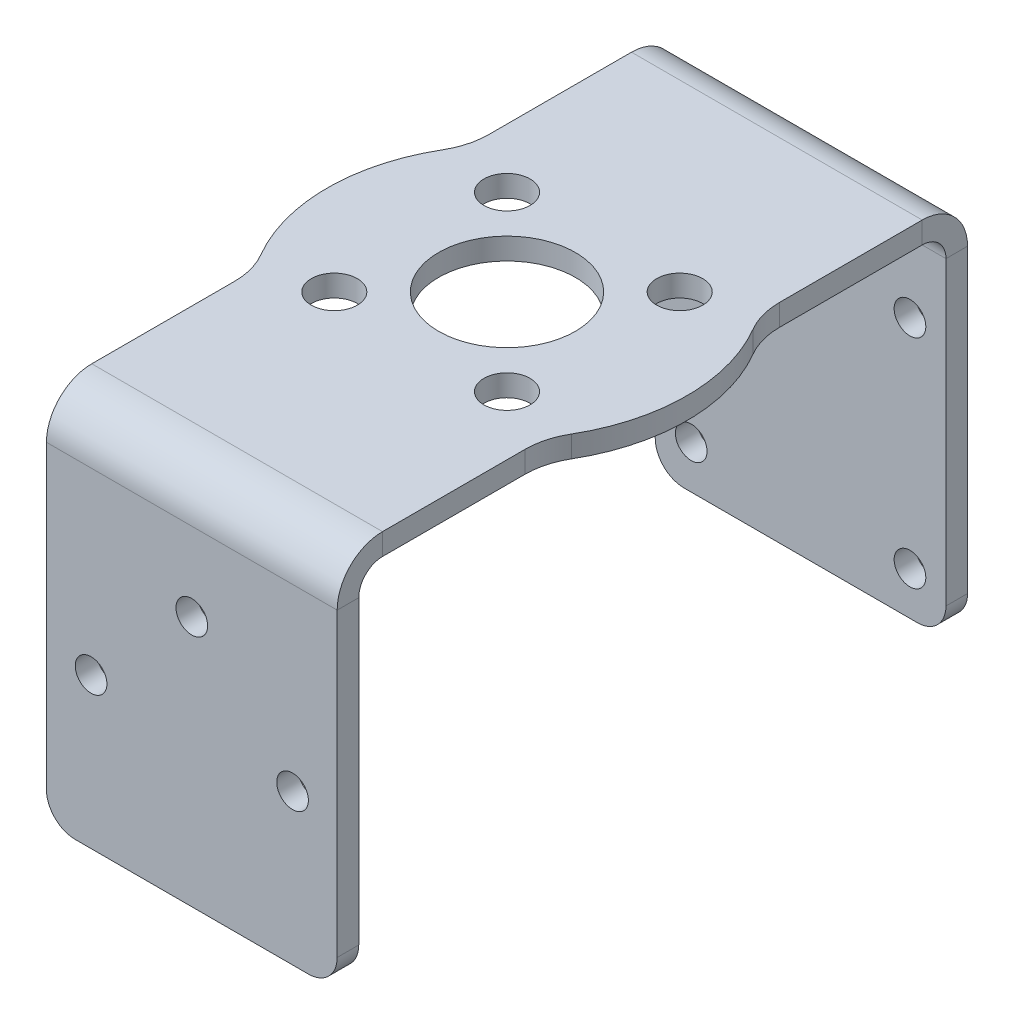
from build123d import *

# Parameters (mm, degrees)
SKETCH1_W                      = 20.2
SKETCH1_H                      = 40.8
BASE_FLANGE1_DEPTH             = 1.5
EDGE_FLANGE1_STRIP_W           = 9.3
EDGE_FLANGE1_STRIP_H           = 1.5
EDGE_FLANGE1_STRIP_CUT_DEPTH   = 20.2
EDGE_FLANGE1_STRIP_2_W         = 9.3
EDGE_FLANGE1_STRIP_2_H         = 1.5
EDGE_FLANGE1_STRIP_CUT_2_DEPTH = 20.2
EDGE_FLANGE1_DEPTH             = 20.2
EDGE_FLANGE1_BEND_DEPTH        = 20.2
CUT_EXTRUDE1_REACH             = 53.952
SKETCH12_R                     = 1.1
FILLET1_R                      = 2
F_2_0MM_DOWEL_HOLE1_D          = 2.2
F_2_0MM_DOWEL_HOLE1_DEPTH      = 1.5
SKETCH15_R                     = 12.5
TAB1_DEPTH                     = 1.5
FILLET2_R                      = 5
CUT_EXTRUDE2_REACH             = 38.256
SKETCH18_R                     = 1.6
SKETCH18_R_2                   = 4.75


# Sheet-metal steps are written as plain solids
with BuildPart() as part:
    # Sketch1 → Base-Flange1 (new body)
    with BuildSketch(Plane(origin=(0, 0, 0), x_dir=(1, 0, 0), z_dir=(0, 1, 0))):
        Rectangle(SKETCH1_W, SKETCH1_H)
    extrude(amount=-BASE_FLANGE1_DEPTH)

    # Edge-Flange1 strip (across the edge) → Edge-Flange1 strip cut (cut)
    with BuildSketch(Plane(origin=(10.1, -1.5, 20.4), x_dir=(0, 0, -1), z_dir=(-1, 0, 0))):
        with Locations((-3, -0.75)):
            Rectangle(EDGE_FLANGE1_STRIP_W, EDGE_FLANGE1_STRIP_H)
    extrude(amount=EDGE_FLANGE1_STRIP_CUT_DEPTH, mode=Mode.SUBTRACT)

    # Edge-Flange1 strip 2 (across the edge) → Edge-Flange1 strip cut 2 (cut)
    with BuildSketch(Plane(origin=(-10.1, -1.5, -20.4), x_dir=(0, 0, 1), z_dir=(1, 0, 0))):
        with Locations((-3, -0.75)):
            Rectangle(EDGE_FLANGE1_STRIP_2_W, EDGE_FLANGE1_STRIP_2_H)
    extrude(amount=EDGE_FLANGE1_STRIP_CUT_2_DEPTH, mode=Mode.SUBTRACT)

    # Edge-Flange1 section (across the edge) → Edge-Flange1 (add)
    with BuildSketch(Plane(origin=(10.1, -1.5, 20.4), x_dir=(0, 0, -1), z_dir=(-1, 0, 0))):
        with BuildLine():
            Line((-1.5, 1.65), (-1.5, 24.55))
            Line((-1.5, 24.55), (0, 24.55))
            Line((0, 24.55), (0, 1.65))
            ThreePointArc((0, 1.65), (0.483273811, 0.483273811), (1.65, 0))
            Line((1.65, 0), (1.65, -1.5))
            ThreePointArc((1.65, -1.5), (-0.577386361, -0.577386361), (-1.5, 1.65))
        make_face()
    extrude(amount=EDGE_FLANGE1_DEPTH)

    # Edge-Flange1 section 2 (across the edge) → Edge-Flange1 bend (add)
    with BuildSketch(Plane(origin=(-10.1, -1.5, -20.4), x_dir=(0, 0, 1), z_dir=(1, 0, 0))):
        with BuildLine():
            Line((-1.5, 1.65), (-1.5, 24.55))
            Line((-1.5, 24.55), (0, 24.55))
            Line((0, 24.55), (0, 1.65))
            ThreePointArc((0, 1.65), (0.483273811, 0.483273811), (1.65, 0))
            Line((1.65, 0), (1.65, -1.5))
            ThreePointArc((1.65, -1.5), (-0.577386361, -0.577386361), (-1.5, 1.65))
        make_face()
    extrude(amount=EDGE_FLANGE1_BEND_DEPTH)

    # Sketch12 → Cut-Extrude1 (cut, up to next)
    with BuildSketch(Plane(origin=(0, 0, -21.9), x_dir=(-1, 0, 0), z_dir=(0, 0, -1)), mode=Mode.PRIVATE) as cut_extrude1_sk1:
        with Locations(Location((-7.6, -7.95, 0), (0, 0, 90))):
            Circle(SKETCH12_R)
    cut_extrude1_tool1 = extrude(cut_extrude1_sk1.sketch, amount=-CUT_EXTRUDE1_REACH, mode=Mode.PRIVATE) & part.part
    # Sketch12 → Cut-Extrude1 (cut, up to next)
    with BuildSketch(Plane(origin=(0, 0, -21.9), x_dir=(-1, 0, 0), z_dir=(0, 0, -1)), mode=Mode.PRIVATE) as cut_extrude1_sk2:
        with Locations(Location((7.6, -7.95, 0), (0, 0, 90))):
            Circle(SKETCH12_R)
    cut_extrude1_tool2 = extrude(cut_extrude1_sk2.sketch, amount=-CUT_EXTRUDE1_REACH, mode=Mode.PRIVATE) & part.part
    # Sketch12 → Cut-Extrude1 (cut, up to next)
    with BuildSketch(Plane(origin=(0, 0, -21.9), x_dir=(-1, 0, 0), z_dir=(0, 0, -1)), mode=Mode.PRIVATE) as cut_extrude1_sk3:
        with Locations(Location((7.6, -23.05, 0), (0, 0, 90))):
            Circle(SKETCH12_R)
    cut_extrude1_tool3 = extrude(cut_extrude1_sk3.sketch, amount=-CUT_EXTRUDE1_REACH, mode=Mode.PRIVATE) & part.part
    # Sketch12 → Cut-Extrude1 (cut, up to next)
    with BuildSketch(Plane(origin=(0, 0, -21.9), x_dir=(-1, 0, 0), z_dir=(0, 0, -1)), mode=Mode.PRIVATE) as cut_extrude1_sk4:
        with Locations(Location((-7.6, -23.05, 0), (0, 0, 90))):
            Circle(SKETCH12_R)
    cut_extrude1_tool4 = extrude(cut_extrude1_sk4.sketch, amount=-CUT_EXTRUDE1_REACH, mode=Mode.PRIVATE) & part.part
    add(cut_extrude1_tool1.solids().sort_by_distance((7.6, -7.95, -21.9))[0], mode=Mode.SUBTRACT)
    add(cut_extrude1_tool2.solids().sort_by_distance((-7.6, -7.95, -21.9))[0], mode=Mode.SUBTRACT)
    add(cut_extrude1_tool3.solids().sort_by_distance((-7.6, -23.05, -21.9))[0], mode=Mode.SUBTRACT)
    add(cut_extrude1_tool4.solids().sort_by_distance((7.6, -23.05, -21.9))[0], mode=Mode.SUBTRACT)

    # Fillet1
    fillet1_edges = [part.edges().sort_by_distance(p)[0] for p in [
        (10.1, -26.05, 21.15),
        (-10.1, -26.05, 21.15),
        (-10.1, -26.05, -21.15),
        (10.1, -26.05, -21.15),
    ]]
    fillet(fillet1_edges, radius=FILLET1_R)

    # Ø2.0mm Dowel Hole1
    with Locations(Plane.XY.offset(21.9)):
        with Locations((-7, -15.6), (0, -8.6), (7, -15.6)):
            Hole(F_2_0MM_DOWEL_HOLE1_D / 2, depth=F_2_0MM_DOWEL_HOLE1_DEPTH)

    # Sketch15 → Tab1 (add)
    with BuildSketch(Plane(origin=(0, 0, 0), x_dir=(1, 0, 0), z_dir=(0, 1, 0))):
        Circle(SKETCH15_R)
    extrude(amount=-TAB1_DEPTH)

    # Fillet2
    fillet2_edges = [part.edges().sort_by_distance(p)[0] for p in [
        (-10.1, -0.75, -7.364781056),
        (-10.1, -0.75, 7.364781056),
        (10.1, -0.75, -7.364781056),
        (10.1, -0.75, 7.364781056),
    ]]
    fillet(fillet2_edges, radius=FILLET2_R)

    # Sketch18 → Cut-Extrude2 (cut, up to next)
    with BuildSketch(Plane(origin=(0, 0, 0), x_dir=(1, 0, 0), z_dir=(0, 1, 0)), mode=Mode.PRIVATE) as cut_extrude2_sk1:
        with Locations(Location((-6, 6, 0), (0, 0, 270))):
            Circle(SKETCH18_R)
    cut_extrude2_tool1 = extrude(cut_extrude2_sk1.sketch, amount=-CUT_EXTRUDE2_REACH, mode=Mode.PRIVATE) & part.part
    # Sketch18 → Cut-Extrude2 (cut, up to next)
    with BuildSketch(Plane(origin=(0, 0, 0), x_dir=(1, 0, 0), z_dir=(0, 1, 0)), mode=Mode.PRIVATE) as cut_extrude2_sk2:
        with Locations(Location((6, 6, 0), (0, 0, 270))):
            Circle(SKETCH18_R)
    cut_extrude2_tool2 = extrude(cut_extrude2_sk2.sketch, amount=-CUT_EXTRUDE2_REACH, mode=Mode.PRIVATE) & part.part
    # Sketch18 → Cut-Extrude2 (cut, up to next)
    with BuildSketch(Plane(origin=(0, 0, 0), x_dir=(1, 0, 0), z_dir=(0, 1, 0)), mode=Mode.PRIVATE) as cut_extrude2_sk3:
        with Locations(Location((-6, -6, 0), (0, 0, 270))):
            Circle(SKETCH18_R)
    cut_extrude2_tool3 = extrude(cut_extrude2_sk3.sketch, amount=-CUT_EXTRUDE2_REACH, mode=Mode.PRIVATE) & part.part
    # Sketch18 → Cut-Extrude2 (cut, up to next)
    with BuildSketch(Plane(origin=(0, 0, 0), x_dir=(1, 0, 0), z_dir=(0, 1, 0)), mode=Mode.PRIVATE) as cut_extrude2_sk4:
        with Locations(Location((6, -6, 0), (0, 0, 270))):
            Circle(SKETCH18_R)
    cut_extrude2_tool4 = extrude(cut_extrude2_sk4.sketch, amount=-CUT_EXTRUDE2_REACH, mode=Mode.PRIVATE) & part.part
    # Sketch18 → Cut-Extrude2 (cut, up to next)
    with BuildSketch(Plane(origin=(0, 0, 0), x_dir=(1, 0, 0), z_dir=(0, 1, 0)), mode=Mode.PRIVATE) as cut_extrude2_sk5:
        with Locations(Location((0, 0, 0), (0, 0, 270))):
            Circle(SKETCH18_R_2)
    cut_extrude2_tool5 = extrude(cut_extrude2_sk5.sketch, amount=-CUT_EXTRUDE2_REACH, mode=Mode.PRIVATE) & part.part
    add(cut_extrude2_tool1.solids().sort_by_distance((-6, 0, -6))[0], mode=Mode.SUBTRACT)
    add(cut_extrude2_tool2.solids().sort_by_distance((6, 0, -6))[0], mode=Mode.SUBTRACT)
    add(cut_extrude2_tool3.solids().sort_by_distance((-6, 0, 6))[0], mode=Mode.SUBTRACT)
    add(cut_extrude2_tool4.solids().sort_by_distance((6, 0, 6))[0], mode=Mode.SUBTRACT)
    add(cut_extrude2_tool5.solids().sort_by_distance((0, 0, 0))[0], mode=Mode.SUBTRACT)


solid = part.part
